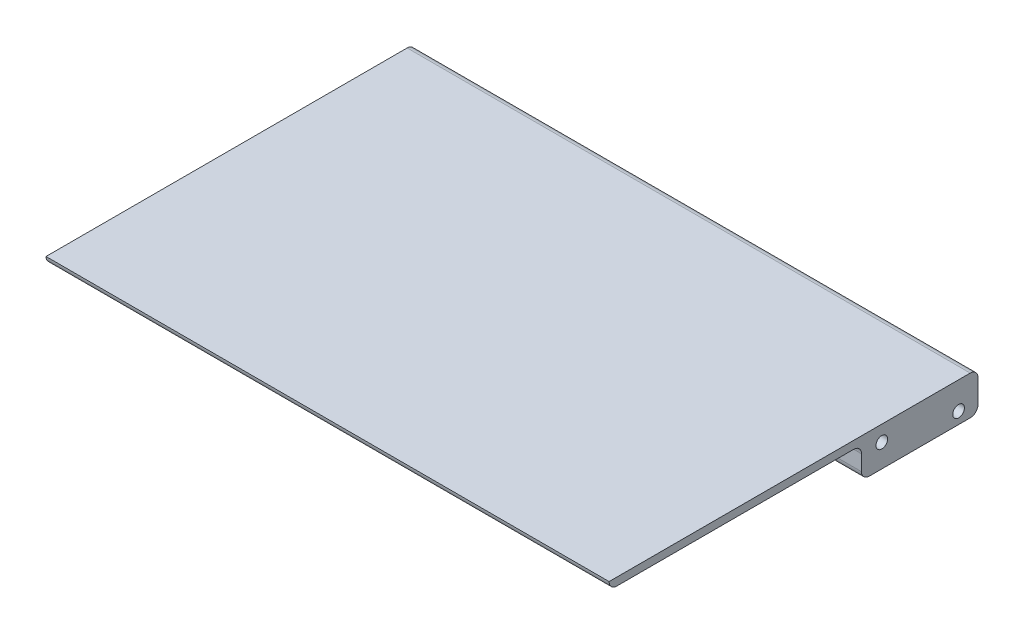
from build123d import *

# Parameters (mm, degrees)
SKETCH_1_W          = 145
SKETCH_1_H          = 95
EXTRUDE_1_DEPTH     = 2
SKETCH_2_W          = 30
SKETCH_2_H          = 8
SKETCH_2_R          = 1.5
EXTRUDE_2_DEPTH     = 145
FILLET_1_R          = 2
CUT_EXTRUDE_2_REACH = 89.25
SKETCH_3_W          = 125
SKETCH_3_H          = 147.268730198


with BuildPart() as part:
    # 草图1 → 凸台-拉伸1 (new body)
    with BuildSketch(Plane(origin=(0, 0, 0), x_dir=(1, 0, 0), z_dir=(0, 1, 0))):
        Rectangle(SKETCH_1_W, SKETCH_1_H)
    extrude(amount=EXTRUDE_1_DEPTH)

    # 草图2 → 凸台-拉伸2 (add, through all)
    with BuildSketch(Plane(origin=(72.5, 0, 0), x_dir=(0, 0, -1), z_dir=(1, 0, 0))):
        with Locations((32.5, -4)):
            Rectangle(SKETCH_2_W, SKETCH_2_H)
        with Locations((22.719682733, -2.043811777)):
            Circle(SKETCH_2_R, mode=Mode.SUBTRACT)
        with Locations((42.5, -5)):
            Circle(SKETCH_2_R, mode=Mode.SUBTRACT)
    extrude(amount=-EXTRUDE_2_DEPTH)

    # 圆角1
    fillet_1_edges = [part.edges().sort_by_distance(p)[0] for p in [
        (0, 2, -47.5),
        (0, -8, -47.5),
        (0, -8, -17.5),
        (0, 0, -17.5),
        (0, 0, 47.5),
    ]]
    fillet(fillet_1_edges, radius=FILLET_1_R - 0.0001)  # a hair under: the kernel refuses the full size

    # 切除-拉伸2: up to this face of the body (flat: up to its plane)
    cut_extrude_2_end = Plane(part.part.faces().sort_by_distance((0, 0, 15))[0])
    # 草图3 → 切除-拉伸2 (cut, up to the picked face)
    with BuildSketch(Plane.XZ.offset(8), mode=Mode.PRIVATE) as cut_extrude_2_sk1:
        Rectangle(SKETCH_3_W, SKETCH_3_H)
    cut_extrude_2_tool1 = split(extrude(cut_extrude_2_sk1.sketch, amount=-CUT_EXTRUDE_2_REACH, mode=Mode.PRIVATE), bisect_by=cut_extrude_2_end, keep=Keep.BOTH, mode=Mode.PRIVATE)
    add(cut_extrude_2_tool1.solids().sort_by(Axis((0, -8, 0), (0, 1, 0)))[0], mode=Mode.SUBTRACT)


solid = part.part
